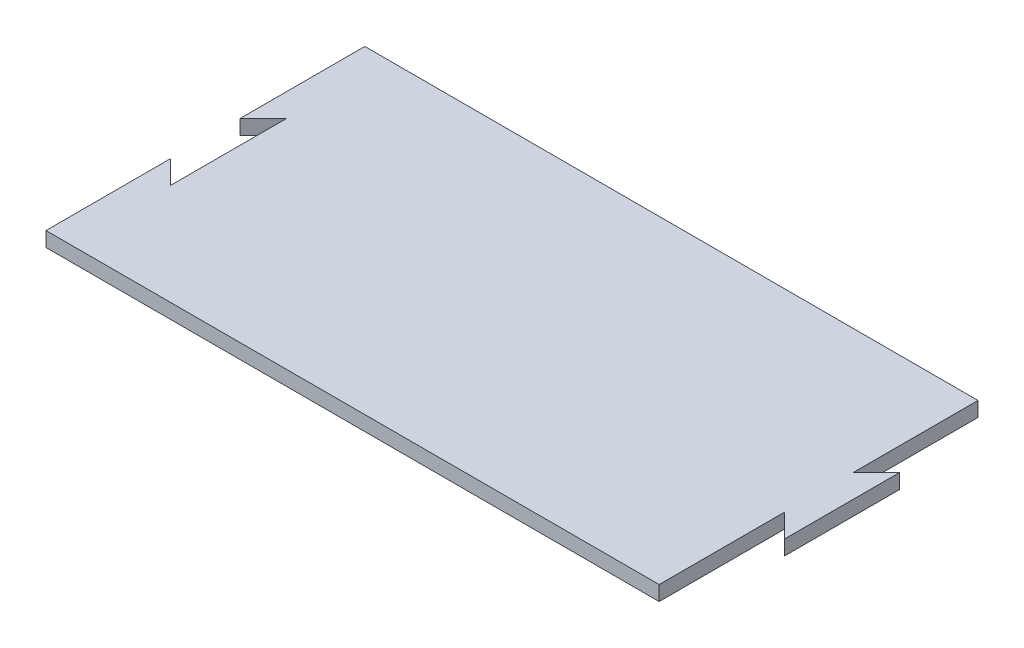
from build123d import *

# Parameters (mm, degrees)
BOSS_EXTRUDE1_DEPTH  = 3.175
SKETCH4_R            = 4
LEFT_AND_RIGHT_DEPTH = 363.060140032


with BuildPart() as part:
    # Sketch1 → Boss-Extrude1 (new, symmetric)
    with BuildSketch(Plane(origin=(0, 0, 0), x_dir=(1, 0, 0), z_dir=(0, 1, 0))):
        Polygon((-354.15, 75), (-354.15, -75), (-260.5, -75), (-260.5, -68.65), (260.5, -68.65), (260.5, -75), (354.15, -75), (354.15, 75), (260.5, 75), (260.5, 68.65), (-260.5, 68.65), (-260.5, 75), align=None)
    extrude(amount=BOSS_EXTRUDE1_DEPTH, both=True)

    # Sketch4 → Left and Right (cut, through all)
    with BuildSketch(Plane.XZ.offset(3.175)):
        with Locations((-326.1, 14.85)):
            Circle(SKETCH4_R)
        with Locations((205.9, 14.85)):
            Circle(SKETCH4_R)
        Polygon((-184.15, -68.65), (-184.15, -15), (-174.15, -25), (-174.15, 25), (-184.15, 15), (-184.15, 68.65), (-184.25, 68.65), (-184.25, 14.758578644), (-174.25, 24.758578644), (-174.25, -24.758578644), (-184.25, -14.758578644), (-184.25, -68.65), align=None)
        Polygon((80, -68.65), (80, -15), (90, -25), (90, 25), (80, 15), (80, 68.65), (79.9, 68.65), (79.9, 14.758578644), (89.9, 24.758578644), (89.9, -24.758578644), (79.9, -14.758578644), (79.9, -68.65), align=None)
    extrude(amount=-LEFT_AND_RIGHT_DEPTH, mode=Mode.SUBTRACT)


with BuildPart() as left_and_right_piece_1:
    # of the separate pieces the step leaves, piece 1, a body of its own (left_and_right_pieces)
    add(part.part.solids().sort_by_distance((260.5, -3.175, -68.65))[0])


with BuildPart() as left_and_right_piece_2:
    # of the separate pieces the step leaves, piece 2, a body of its own (left_and_right_pieces)
    add(part.part.solids().sort_by_distance((79.9, -3.175, -68.65))[0])


with BuildPart() as left_and_right_piece_3:
    # of the separate pieces the step leaves, piece 3, a body of its own (left_and_right_pieces)
    add(part.part.solids().sort_by_distance((-354.15, -3.175, -75))[0])


solid = left_and_right_piece_2.part
